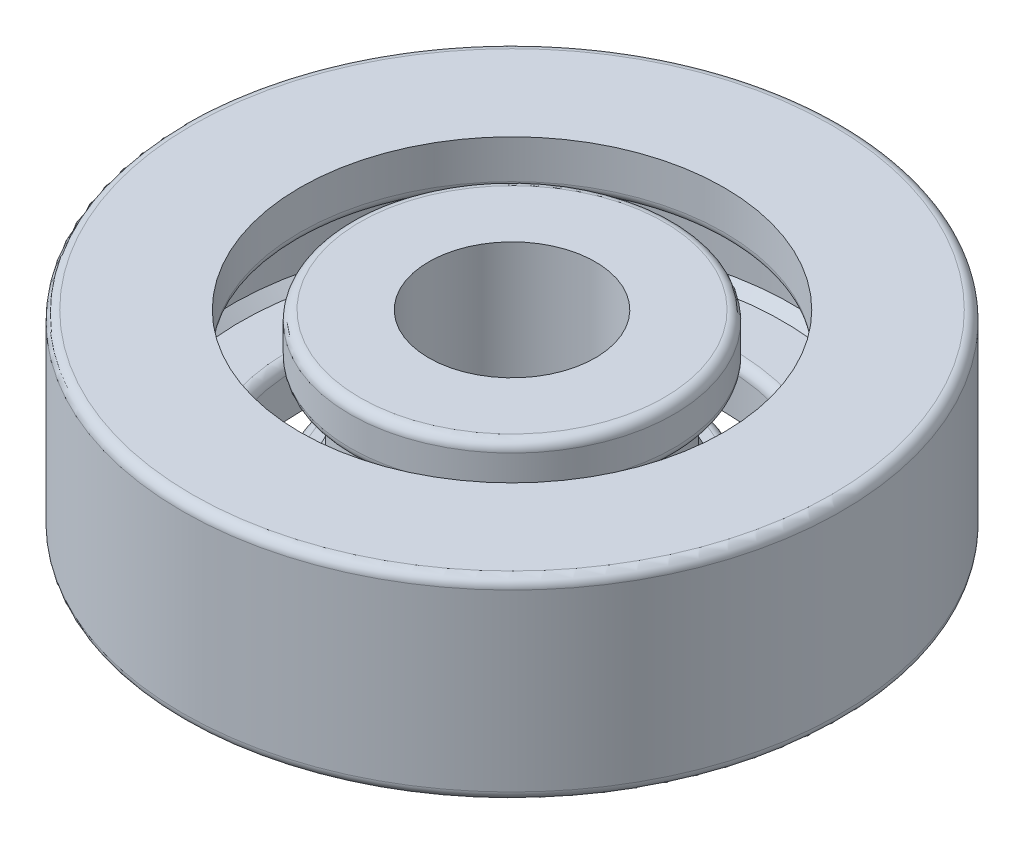
from build123d import *

# Parameters (mm, degrees)
SKETCH_1_R      = 57.851422948
SKETCH_1_R_2    = 43.64152647
EXTRUDE_1_DEPTH = 20
SKETCH_2_R      = 33.313406782
SKETCH_2_R_2    = 27.150728385
EXTRUDE_2_DEPTH = 20
SHELL_1_T       = 10
SHELL_2_T       = 10
FILLET_1_R      = 2
FILLET_2_R      = 2
FILLET_3_R      = 2
FILLET_4_R      = 2
CHAMFER_1_SIZE  = 2
FILLET_5_R      = 2
CHAMFER_2_SIZE  = 2


with BuildPart() as part:
    # 草图1 → 凸台-拉伸1 (new body)
    with BuildSketch(Plane(origin=(0, 0, 0), x_dir=(1, 0, 0), z_dir=(0, 1, 0))):
        with Locations(Location((0, 0, 0), (0, 0, 270))):
            Circle(SKETCH_1_R)
        with Locations(Location((0, 0, 0), (0, 0, 270))):
            Circle(SKETCH_1_R_2, mode=Mode.SUBTRACT)
    extrude(amount=EXTRUDE_1_DEPTH)

    # 抽壳1
    shell_1_openings = [part.faces().sort_by_distance(p)[0] for p in [
        (0, 10, -43.64152647),
    ]]
    offset(amount=SHELL_1_T, openings=shell_1_openings, kind=Kind.INTERSECTION)

    # 圆角1
    # the kernel refuses this fillet: 2 mm, written as the material it takes off along each edge
    with BuildSketch(Plane(origin=(0, 0, 0), x_dir=(0, 0, 1), z_dir=(-1, 0, 0))) as fillet_1_piece_1:
        with BuildLine():
            CenterArc((43.64152647 + FILLET_1_R, -FILLET_1_R), FILLET_1_R, 90, 90)
            Line((43.64152647, -FILLET_1_R), (43.64152647, 0))
            Line((43.64152647, 0), (43.64152647 + FILLET_1_R, 0))
        make_face()
    revolve(axis=Axis((0, 0, 0), (0, 1, 0)), mode=Mode.SUBTRACT)

    # 圆角2
    fillet_2_edges = [part.edges().sort_by_distance(p)[0] for p in [
        (0, 20, -43.64152647),
    ]]
    fillet(fillet_2_edges, radius=FILLET_2_R)

    # 圆角3
    fillet_3_edges = [part.edges().sort_by_distance(p)[0] for p in [
        (0, 30, -67.851422948),
    ]]
    fillet(fillet_3_edges, radius=FILLET_3_R)

    # 圆角4
    fillet_4_edges = [part.edges().sort_by_distance(p)[0] for p in [
        (0, -10, -67.851422948),
    ]]
    fillet(fillet_4_edges, radius=FILLET_4_R)

    # 倒角1
    chamfer_1_edges = [part.edges().sort_by_distance(p)[0] for p in [
        (0, 20, -57.851422948),
        (0, 0, -57.851422948),
    ]]
    chamfer(chamfer_1_edges, length=CHAMFER_1_SIZE)


with BuildPart() as body_2:
    # 草图2 → 凸台-拉伸2 (new body)
    with BuildSketch(Plane(origin=(0, 0, 0), x_dir=(1, 0, 0), z_dir=(0, 1, 0))):
        with Locations(Location((0, 0, 0), (0, 0, 270))):
            Circle(SKETCH_2_R)
        with Locations(Location((0, 0, 0), (0, 0, 270))):
            Circle(SKETCH_2_R_2, mode=Mode.SUBTRACT)
    extrude(amount=EXTRUDE_2_DEPTH)

    # 抽壳2
    shell_2_openings = [body_2.faces().sort_by_distance(p)[0] for p in [
        (0, 10, -33.313406782),
    ]]
    offset(amount=SHELL_2_T, openings=shell_2_openings, kind=Kind.INTERSECTION)

    # 圆角5
    # the kernel refuses this fillet: 2 mm, written as the material it takes off along each edge
    with BuildSketch(Plane(origin=(0, 20, 0), x_dir=(0, 0, 1), z_dir=(-1, 0, 0))) as fillet_5_piece_1:
        with BuildLine():
            CenterArc((33.313406782 - FILLET_5_R, FILLET_5_R), FILLET_5_R, 270, 90)
            Line((33.313406782, FILLET_5_R), (33.313406782, 0))
            Line((33.313406782, 0), (33.313406782 - FILLET_5_R, 0))
        make_face()
    revolve(axis=Axis((0, 20, 0), (0, 1, 0)), mode=Mode.SUBTRACT)
    with BuildSketch(Plane(origin=(0, 0, 0), x_dir=(0, 0, 1), z_dir=(-1, 0, 0))) as fillet_5_piece_2:
        with BuildLine():
            CenterArc((33.313406782 - FILLET_5_R, -FILLET_5_R), FILLET_5_R, 0, 90)
            Line((33.313406782, -FILLET_5_R), (33.313406782, 0))
            Line((33.313406782, 0), (33.313406782 - FILLET_5_R, 0))
        make_face()
    revolve(axis=Axis((0, 0, 0), (0, 1, 0)), mode=Mode.SUBTRACT)
    with BuildSketch(Plane(origin=(0, -10, 0), x_dir=(0, 0, 1), z_dir=(1, 0, 0))) as fillet_5_piece_3:
        with BuildLine():
            CenterArc((33.313406782 - FILLET_5_R, -FILLET_5_R), FILLET_5_R, 0, 90)
            Line((33.313406782 - FILLET_5_R, 0), (33.313406782, 0))
            Line((33.313406782, 0), (33.313406782, -FILLET_5_R))
        make_face()
    revolve(axis=Axis((0, -10, 0), (0, -1, 0)), mode=Mode.SUBTRACT)
    with BuildSketch(Plane(origin=(0, 30, 0), x_dir=(0, 0, 1), z_dir=(1, 0, 0))) as fillet_5_piece_4:
        with BuildLine():
            CenterArc((33.313406782 - FILLET_5_R, FILLET_5_R), FILLET_5_R, 270, 90)
            Line((33.313406782 - FILLET_5_R, 0), (33.313406782, 0))
            Line((33.313406782, 0), (33.313406782, FILLET_5_R))
        make_face()
    revolve(axis=Axis((0, 30, 0), (0, -1, 0)), mode=Mode.SUBTRACT)

    # 倒角2
    chamfer_2_edges = [body_2.edges().sort_by_distance(p)[0] for p in [
        (0, 0, -27.150728385),
        (0, 20, -27.150728385),
    ]]
    chamfer(chamfer_2_edges, length=CHAMFER_2_SIZE)


solid = Compound([part.part, body_2.part])
